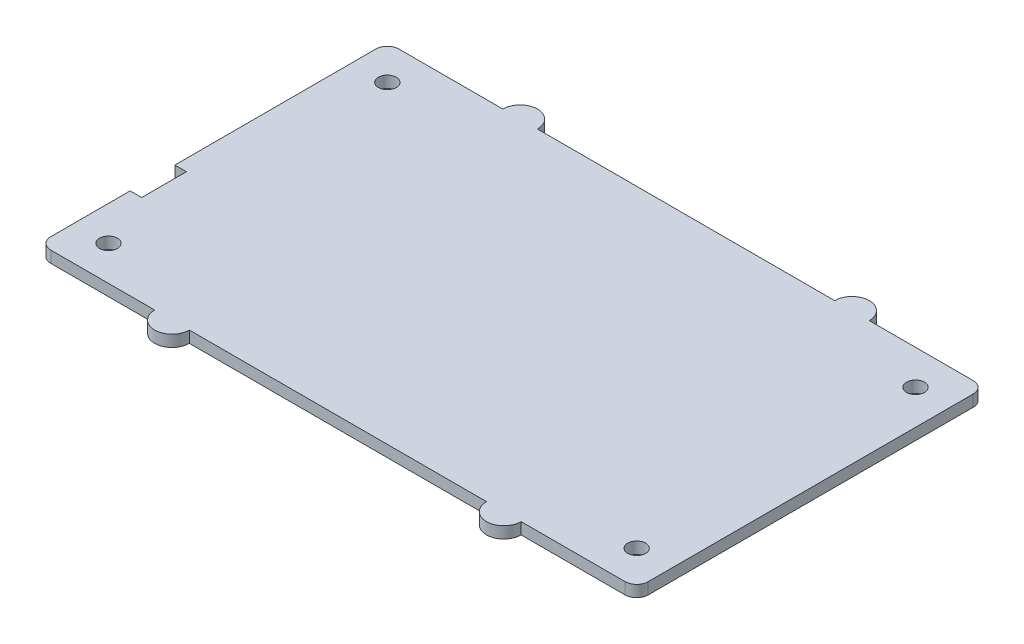
from build123d import *

# Parameters (mm, degrees)
SKETCH_1_R      = 1.55
EXTRUDE_1_DEPTH = 2


with BuildPart() as part:
    # 草图1 → 凸台-拉伸1 (new body)
    with BuildSketch(Plane(origin=(0, 0, 0), x_dir=(1, 0, 0), z_dir=(0, 1, 0))):
        with BuildLine():
            Line((97.46, -4), (97.46, 52.29))
            ThreePointArc((97.46, 52.29), (96.874213562, 53.704213562), (95.46, 54.29))
            Line((95.46, 54.29), (77.46, 54.29))
            ThreePointArc((77.46, 54.29), (74.46, 57.29), (71.46, 54.29))
            Line((71.46, 54.29), (20, 54.29))
            ThreePointArc((20, 54.29), (17, 57.29), (14, 54.29))
            Line((14, 54.29), (-4, 54.29))
            ThreePointArc((-4, 54.29), (-5.414213562, 53.704213562), (-6, 52.29))
            Line((-6, 52.29), (-6, 17.493898271))
            Line((-6, 17.493898271), (-4, 17.493898271))
            Line((-4, 17.493898271), (-4, 9.75))
            Line((-4, 9.75), (-6, 9.75))
            Line((-6, 9.75), (-6, -4))
            ThreePointArc((-6, -4), (-5.414213562, -5.414213562), (-4, -6))
            Line((-4, -6), (14, -6))
            ThreePointArc((14, -6), (17, -9), (20, -6))
            Line((20, -6), (71.46, -6))
            ThreePointArc((71.46, -6), (74.46, -9), (77.46, -6))
            Line((77.46, -6), (95.46, -6))
            ThreePointArc((95.46, -6), (96.874213562, -5.414213562), (97.46, -4))
        make_face()
        Circle(SKETCH_1_R, mode=Mode.SUBTRACT)
        with Locations((91.46, 0)):
            Circle(SKETCH_1_R, mode=Mode.SUBTRACT)
        with Locations((0, 48.29)):
            Circle(SKETCH_1_R, mode=Mode.SUBTRACT)
        with Locations((91.46, 48.29)):
            Circle(SKETCH_1_R, mode=Mode.SUBTRACT)
    extrude(amount=EXTRUDE_1_DEPTH)


solid = part.part
